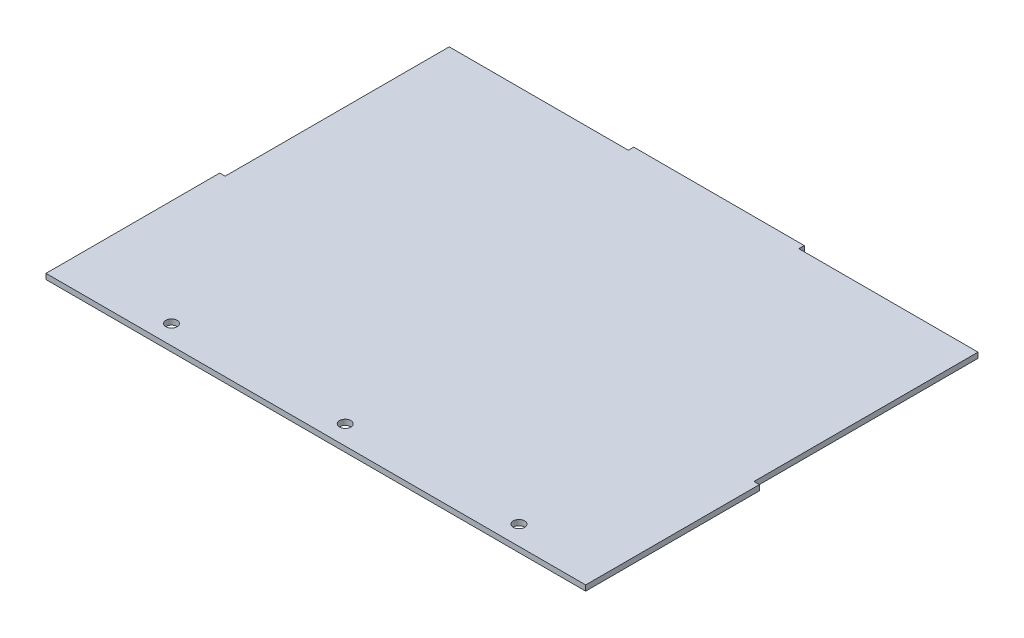
from build123d import *

# Parameters (mm, degrees)
SKETCH1_W           = 315.58
SKETCH1_H           = 3.175
BOSS_EXTRUDE1_DEPTH = 232.600000128
SKETCH5_W           = 3.175
SKETCH5_H           = 130.999992
CUT_EXTRUDE2_DEPTH  = 282.088108579
SKETCH7_R           = 3.302
CUT_EXTRUDE3_DEPTH  = 282.088108579
LPATTERN1_COUNT     = 3
LPATTERN1_PITCH     = 101.6
SKETCH10_W          = 99.68
SKETCH10_H          = 3.175
BOSS_EXTRUDE2_DEPTH = 3.175


with BuildPart() as part:
    # Sketch1 → Boss-Extrude1 (new body)
    with BuildSketch(Plane.XY):
        Rectangle(SKETCH1_W, SKETCH1_H)
    extrude(amount=BOSS_EXTRUDE1_DEPTH)

    # Sketch5 → Cut-Extrude2 (cut, symmetric)
    with BuildSketch(Plane(origin=(0, 1.5875, 0), x_dir=(1, 0, 0), z_dir=(0, 1, 0))):
        with Locations((-156.2025, -65.499996)):
            Rectangle(SKETCH5_W, SKETCH5_H)
    cut_extrude2 = extrude(amount=CUT_EXTRUDE2_DEPTH, both=True, mode=Mode.SUBTRACT)

    # Mirror1: Cut-Extrude2 across plane
    add(cut_extrude2.mirror(Plane(origin=(0, 0, 0), x_dir=(0, 0, 1), z_dir=(1, 0, 0))), mode=Mode.SUBTRACT)

    # Sketch7 → Cut-Extrude3 (cut, through all)
    with BuildSketch(Plane.XZ.offset(1.5875)):
        with Locations((107.495393219, 221.30835)):
            Circle(SKETCH7_R)
    cut_extrude3 = extrude(amount=-CUT_EXTRUDE3_DEPTH, mode=Mode.SUBTRACT)

    # LPattern1: Cut-Extrude3 ×3
    with Locations(*[(-i * LPATTERN1_PITCH, 0, 0) for i in range(1, LPATTERN1_COUNT)]):
        add(cut_extrude3, mode=Mode.SUBTRACT)

    # Sketch10 → Boss-Extrude2 (add)
    with BuildSketch(Plane(origin=(0, 0, 0), x_dir=(-1, 0, 0), z_dir=(0, 0, -1))):
        Rectangle(SKETCH10_W, SKETCH10_H)
    extrude(amount=BOSS_EXTRUDE2_DEPTH)


solid = part.part
